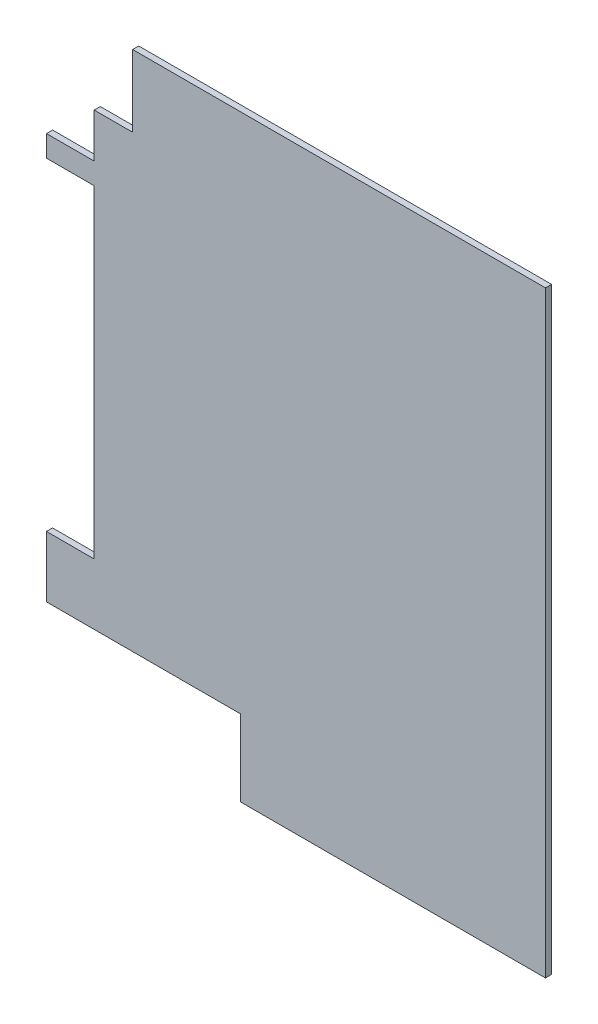
from build123d import *

# Parameters (mm, degrees)
BOSS_EXTRUDE1_DEPTH = 4


with BuildPart() as part:
    # Sketch1 → Boss-Extrude1 (new body)
    with BuildSketch(Plane.XY):
        Polygon((-5.782297403, 1), (-5.782297403, -13), (25.5, -13), (25.5, -225), (-5.82455923, -225), (-5.82455923, -265), (121.5, -265), (121.5, -315), (321.5, -315), (321.5, 77), (50.748117859, 77), (50.748117859, 30), (25.5, 30), (25.5, 1), align=None)
    extrude(amount=BOSS_EXTRUDE1_DEPTH)


solid = part.part
